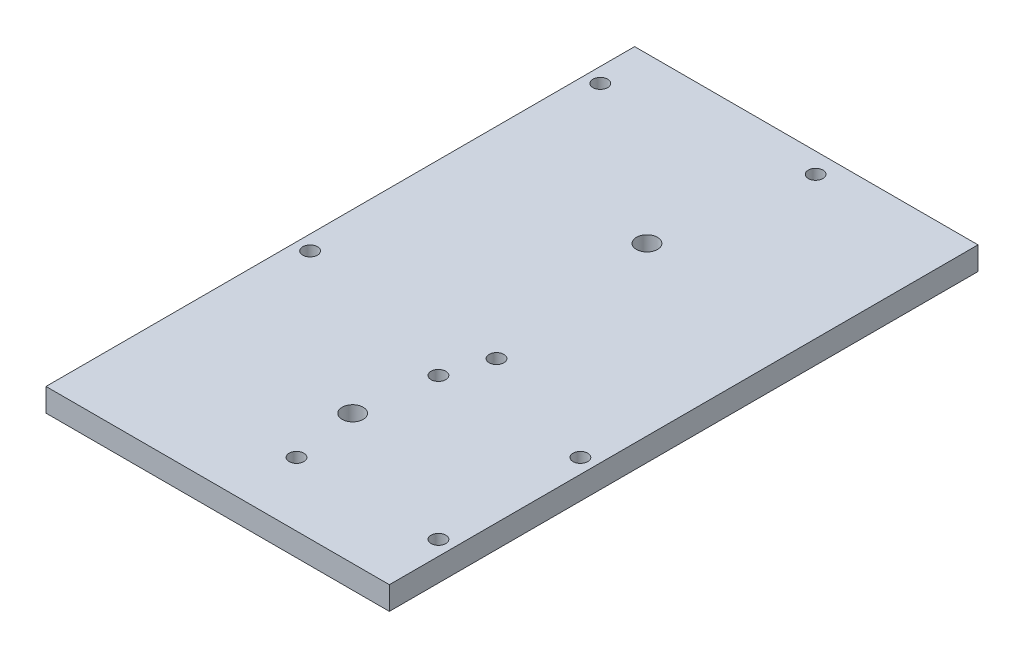
from build123d import *

# Parameters (mm, degrees)
SKETCH2_W               = 88.9
SKETCH2_H               = 152.4
BOSS_EXTRUDE1_DEPTH     = 5.9944
CUT_EXTRUDE1_DEPTH      = 177.535840076
CUT_EXTRUDE1_DEPTH_BACK = 177.535840076
SKETCH3_R               = 1.905
CUT_EXTRUDE2_DEPTH      = 177.535840076
CUT_EXTRUDE2_DEPTH_BACK = 177.535840076
SKETCH4_R               = 2.7305


with BuildPart() as part:
    # Sketch2 → Boss-Extrude1 (new body)
    with BuildSketch(Plane(origin=(0, 0, 0), x_dir=(1, 0, 0), z_dir=(0, 1, 0))):
        with Locations((44.45, 76.2)):
            Rectangle(SKETCH2_W, SKETCH2_H)
    extrude(amount=BOSS_EXTRUDE1_DEPTH)

    # Sketch3 → Cut-Extrude1 (cut, two sides: drawn at the far end of the back side and taken through both)
    with BuildSketch(Plane(origin=(0, 5.9944, 0), x_dir=(1, 0, 0), z_dir=(0, 1, 0)).offset(-CUT_EXTRUDE1_DEPTH_BACK)):
        with Locations((52.07, 147.193)):
            Circle(SKETCH3_R)
        with Locations((3.81, 139.7)):
            Circle(SKETCH3_R)
        with Locations((3.81, 64.5668)):
            Circle(SKETCH3_R)
        with Locations((52.07, 64.5668)):
            Circle(SKETCH3_R)
        with Locations((48.3362, 53.2638)):
            Circle(SKETCH3_R)
        with Locations((85.09, 53.2638)):
            Circle(SKETCH3_R)
        with Locations((48.3362, 16.51)):
            Circle(SKETCH3_R)
        with Locations((85.09, 16.51)):
            Circle(SKETCH3_R)
    extrude(amount=CUT_EXTRUDE1_DEPTH + CUT_EXTRUDE1_DEPTH_BACK, mode=Mode.SUBTRACT)

    # Sketch4 → Cut-Extrude2 (cut, two sides: drawn at the far end of the back side and taken through both)
    with BuildSketch(Plane(origin=(0, 5.9944, 0), x_dir=(1, 0, 0), z_dir=(0, 1, 0)).offset(-CUT_EXTRUDE2_DEPTH_BACK)):
        with Locations((45.72, 109.871331367)):
            Circle(SKETCH4_R)
        with Locations((45.72, 33.671331367)):
            Circle(SKETCH4_R)
    extrude(amount=CUT_EXTRUDE2_DEPTH + CUT_EXTRUDE2_DEPTH_BACK, mode=Mode.SUBTRACT)


solid = part.part
